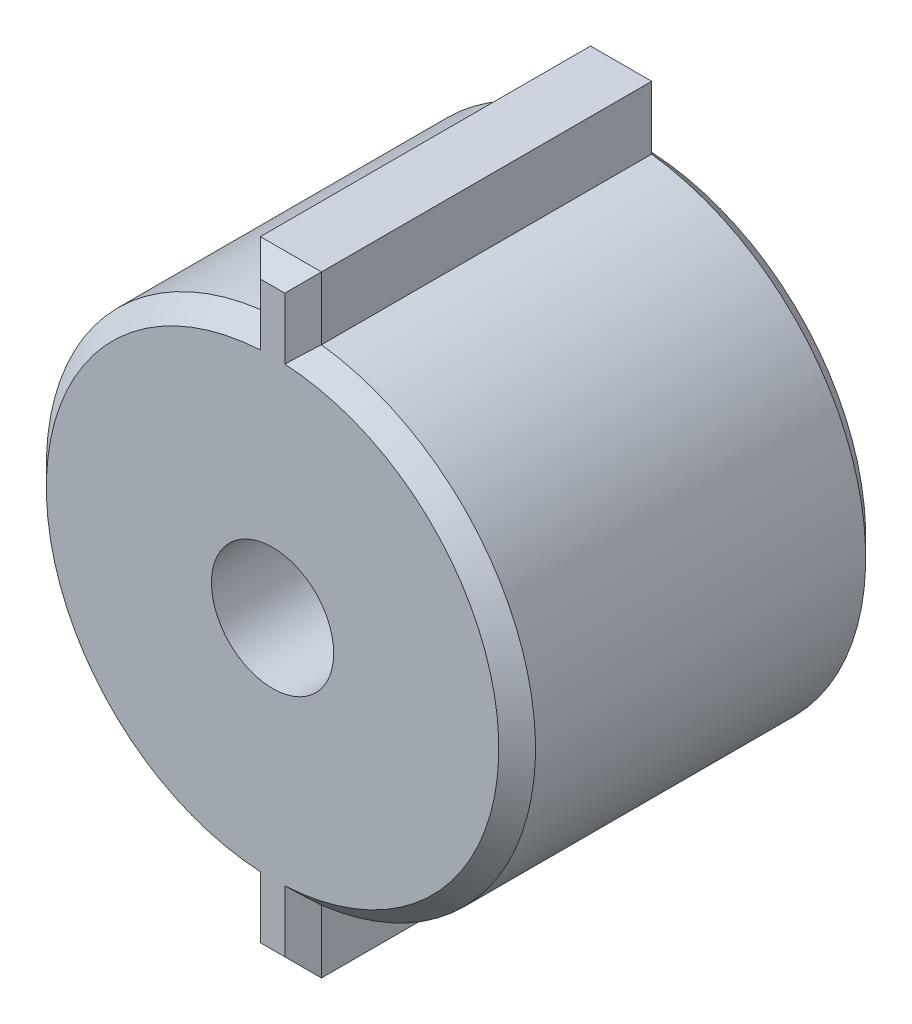
from build123d import *

# Parameters (mm, degrees)
SKETCH1_R           = 0.5
BOSS_EXTRUDE1_DEPTH = 1.5
CHAMFER1_SIZE       = 0.15


with BuildPart() as part:
    # Sketch1 → Boss-Extrude1 (new, symmetric)
    with BuildSketch(Plane.XY):
        with BuildLine():
            Line((-0.25, -2.5), (0.25, -2.5))
            Line((0.25, -2.5), (0.25, -1.984313483))
            ThreePointArc((0.25, -1.984313483), (2, 0), (0.25, 1.984313483))
            Line((0.25, 1.984313483), (0.25, 2.5))
            Line((0.25, 2.5), (-0.25, 2.5))
            Line((-0.25, 2.5), (-0.25, 1.984313483))
            ThreePointArc((-0.25, 1.984313483), (-2, 0), (-0.25, -1.984313483))
            Line((-0.25, -1.984313483), (-0.25, -2.5))
        make_face()
        Circle(SKETCH1_R, mode=Mode.SUBTRACT)
    extrude(amount=BOSS_EXTRUDE1_DEPTH, both=True)

    # Chamfer1
    chamfer1_edges = [part.edges().sort_by_distance(p)[0] for p in [
        (-0.25, -2.242156742, -1.5),
        (0, -2.5, -1.5),
        (0.25, -2.242156742, -1.5),
        (2, 0, -1.5),
        (0.25, 2.242156742, -1.5),
        (0, 2.5, -1.5),
        (-0.25, 2.242156742, -1.5),
        (-2, 0, -1.5),
        (-0.25, 2.242156742, 1.5),
        (0, 2.5, 1.5),
        (0.25, 2.242156742, 1.5),
        (2, 0, 1.5),
        (0.25, -2.242156742, 1.5),
        (0, -2.5, 1.5),
        (-0.25, -2.242156742, 1.5),
        (-2, 0, 1.5),
    ]]
    chamfer(chamfer1_edges, length=CHAMFER1_SIZE)


solid = part.part
